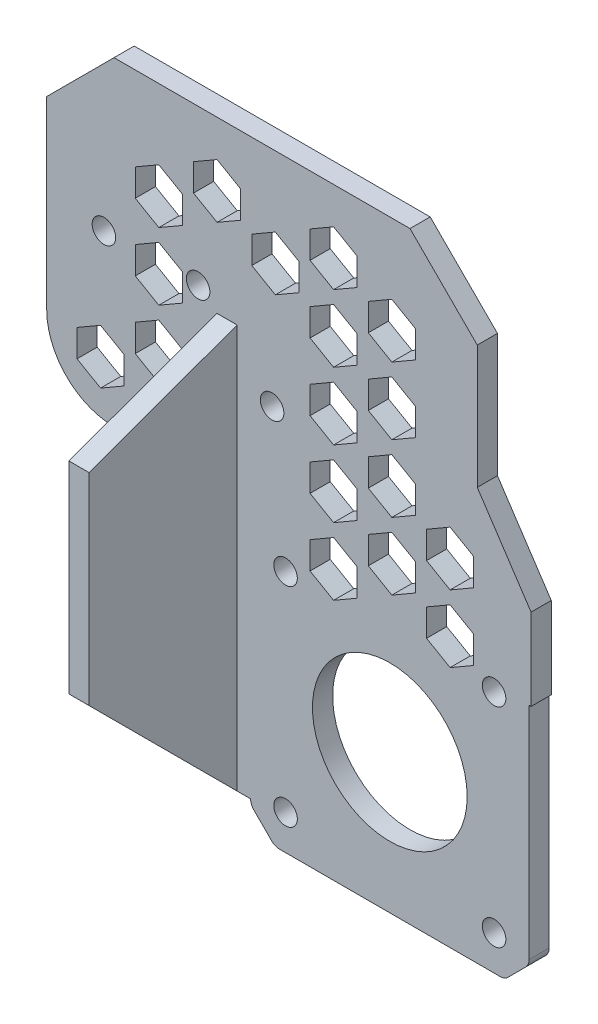
from build123d import *

# Parameters (mm, degrees)
SKETCH2_R               = 1.75
BOSS_EXTRUDE1_DEPTH     = 3
BOSS_EXTRUDE1_2_DEPTH   = 3
BOSS_EXTRUDE2_START     = -3
BOSS_EXTRUDE2_DEPTH     = 3
SKETCH5_W               = 3
SKETCH5_H               = 37.771572876
BOSS_EXTRUDE3_DEPTH     = 2
BOSS_EXTRUDE4_DEPTH     = 3
CUT_EXTRUDE1_DEPTH      = 10
SKETCH9_R               = 11.5
CUT_EXTRUDE2_DEPTH      = 10
FILL_PATTERN1_OUTLINE_R = 1.75
FILL_PATTERN1_DEPTH     = 3


# Read off the part's stored shape, not the designer's step: Fill Pattern1
with BuildPart() as part:
    # Sketch2 → Boss-Extrude1 (new body)
    with BuildSketch(Plane.XY):
        with BuildLine():
            Line((31.67162959, -17.664113805), (31.67162959, 9.835886195))
            Line((31.67162959, 9.835886195), (21.67162959, 19.835886195))
            Line((21.67162959, 19.835886195), (-22.32837041, 19.835886195))
            Line((-22.32837041, 19.835886195), (-32.32837041, 9.835886195))
            Line((-32.32837041, 9.835886195), (-32.32837041, -17.664113805))
            ThreePointArc((-32.32837041, -17.664113805), (-29.399438222, -24.735181617), (-22.32837041, -27.664113805))
            Line((-22.32837041, -27.664113805), (21.67162959, -27.664113805))
            ThreePointArc((21.67162959, -27.664113805), (28.742697402, -24.735181617), (31.67162959, -17.664113805))
        make_face()
        with Locations((18.67162959, 5.585886195)):
            Circle(SKETCH2_R, mode=Mode.SUBTRACT)
        with Locations((1.17162959, -13.314113805)):
            Circle(SKETCH2_R, mode=Mode.SUBTRACT)
        with Locations((-23.82837041, -3.214113805)):
            Circle(SKETCH2_R, mode=Mode.SUBTRACT)
        with Locations((-9.82837041, -3.214113805)):
            Circle(SKETCH2_R, mode=Mode.SUBTRACT)
    extrude(amount=BOSS_EXTRUDE1_DEPTH)



with BuildPart() as body_2:
    # Sketch2 → Boss-Extrude1 2 (new body)
    with BuildSketch(Plane.XY):
        with BuildLine():
            Line((-2.02837041, -32.69254093), (-2.02837041, -65.435686681))
            ThreePointArc((-2.02837041, -65.435686681), (-1.898965615, -66.086248516), (-1.530451938, -66.637768209))
            Line((-1.530451938, -66.637768209), (1.097975187, -69.266195333))
            ThreePointArc((1.097975187, -69.266195333), (1.64949488, -69.634709011), (2.300056715, -69.764113805))
            Line((2.300056715, -69.764113805), (35.043202465, -69.764113805))
            ThreePointArc((35.043202465, -69.764113805), (35.6937643, -69.634709011), (36.245283993, -69.266195333))
            Line((36.245283993, -69.266195333), (38.873711118, -66.637768209))
            ThreePointArc((38.873711118, -66.637768209), (39.242224795, -66.086248516), (39.37162959, -65.435686681))
            Line((39.37162959, -65.435686681), (39.37162959, -32.69254093))
            ThreePointArc((39.37162959, -32.69254093), (39.242224795, -32.041979095), (38.873711118, -31.490459402))
            Line((38.873711118, -31.490459402), (36.245283993, -28.862032277))
            ThreePointArc((36.245283993, -28.862032277), (35.6937643, -28.4935186), (35.043202465, -28.364113805))
            Line((35.043202465, -28.364113805), (2.300056715, -28.364113805))
            ThreePointArc((2.300056715, -28.364113805), (1.64949488, -28.4935186), (1.097975187, -28.862032277))
            Line((1.097975187, -28.862032277), (-1.530451938, -31.490459402))
            ThreePointArc((-1.530451938, -31.490459402), (-1.898965615, -32.041979095), (-2.02837041, -32.69254093))
        make_face()
        with Locations((34.17162959, -33.564113805)):
            Circle(SKETCH2_R, mode=Mode.SUBTRACT)
        with Locations((3.17162959, -33.564113805)):
            Circle(SKETCH2_R, mode=Mode.SUBTRACT)
        with Locations((34.17162959, -64.564113805)):
            Circle(SKETCH2_R, mode=Mode.SUBTRACT)
        with Locations((3.17162959, -64.564113805)):
            Circle(SKETCH2_R, mode=Mode.SUBTRACT)
    extrude(amount=BOSS_EXTRUDE1_2_DEPTH)


with BuildPart() as part_1:
    add(part.part)

    add(body_2.part)  # Boss-Extrude2 merges body 2
    # Sketch3 → Boss-Extrude2 (add)
    with BuildSketch(Plane.XY.offset(3).offset(BOSS_EXTRUDE2_START)):
        with BuildLine():
            Line((-2.02837041, -32.69254093), (-2.02837041, -27.664113805))
            Line((-2.02837041, -27.664113805), (21.67162959, -27.664113805))
            ThreePointArc((21.67162959, -27.664113805), (28.742697402, -24.735181617), (31.67162959, -17.664113805))
            Line((31.67162959, -17.664113805), (31.67162959, -8.484617852))
            Line((31.67162959, -8.484617852), (39.67162959, -20.545709175))
            Line((39.67162959, -20.545709175), (39.67162959, -32.69254093))
            Line((39.67162959, -32.69254093), (35.689147538, -32.69254093))
            ThreePointArc((35.689147538, -32.69254093), (34.17162959, -31.814113805), (32.654111642, -32.69254093))
            Line((32.654111642, -32.69254093), (4.689147538, -32.69254093))
            ThreePointArc((4.689147538, -32.69254093), (3.17162959, -31.814113805), (1.654111642, -32.69254093))
            Line((1.654111642, -32.69254093), (-2.02837041, -32.69254093))
        make_face()
    extrude(amount=BOSS_EXTRUDE2_DEPTH)

    # Sketch5 → Boss-Extrude3 (add)
    with BuildSketch(Plane.ZY.offset(2.02837041)):
        with Locations((1.5, -46.549900243)):
            Rectangle(SKETCH5_W, SKETCH5_H)
    extrude(amount=BOSS_EXTRUDE3_DEPTH)

    # Sketch6 → Boss-Extrude4 (add)
    with BuildSketch(Plane.ZY.offset(4.02837041)):
        Polygon((3, -27.664113805), (0, -27.664113805), (0, -65.435686681), (3, -65.435686681), (25, -43.435686681), (25, -13.435686681), (3, -5.428341527), align=None)
    extrude(amount=BOSS_EXTRUDE4_DEPTH)

    # Sketch7 → Cut-Extrude1 (cut)
    with BuildSketch(Plane.XY.offset(3)):
        Polygon((-24.32837041, -23.70556569), (-20.82837041, -21.684839748), (-20.82837041, -17.643387863), (-24.32837041, -15.622661921), (-27.82837041, -17.643387863), (-27.82837041, -21.684839748), align=None)
    extrude(amount=-CUT_EXTRUDE1_DEPTH, mode=Mode.SUBTRACT)

    # Sketch9 → Cut-Extrude2 (cut)
    with BuildSketch(Plane.XY.offset(3)):
        with Locations((18.67162959, -49.064113805)):
            Circle(SKETCH9_R)
    extrude(amount=-CUT_EXTRUDE2_DEPTH, mode=Mode.SUBTRACT)

    # Fill Pattern1 outline → Fill Pattern1 (cut)
    # profile 1 of 16: a face of its own
    with BuildSketch(Plane.XY):
        Polygon((13.812645741, 2.356612137), (10.312645741, 4.377338079), (6.812645741, 2.356612137), (6.812645741, -1.684839748), (10.312645741, -3.70556569), (13.812645741, -1.684839748), align=None)
    # profile 2 of 16: a face of its own
    with BuildSketch(Plane.XY):
        Polygon((22.472899779, 7.356612137), (18.972899779, 9.377338079), (15.472899779, 7.356612137), (15.472899779, 3.315160252), (18.972899779, 1.29443431), (22.472899779, 3.315160252), align=None)
        with Locations((18.67162959, 5.585886195)):
            Circle(FILL_PATTERN1_OUTLINE_R, mode=Mode.SUBTRACT)
    # profile 3 of 16: a face of its own
    with BuildSketch(Plane.XY):
        Polygon((-12.168116372, -12.643387863), (-15.668116372, -10.622661921), (-19.168116372, -12.643387863), (-19.168116372, -16.684839748), (-15.668116372, -18.70556569), (-12.168116372, -16.684839748), align=None)
    # profile 4 of 16: a face of its own
    with BuildSketch(Plane.XY):
        Polygon((6.812645741, -27.643387863), (6.812645741, -31.684839748), (10.312645741, -33.70556569), (13.812645741, -31.684839748), (13.812645741, -27.643387863), (10.312645741, -25.622661921), align=None)
    # profile 5 of 16: a face of its own
    with BuildSketch(Plane.XY):
        Polygon((10.312645741, 14.377338079), (6.812645741, 12.356612137), (6.812645741, 8.315160252), (10.312645741, 6.29443431), (13.812645741, 8.315160252), (13.812645741, 12.356612137), align=None)
    # profile 6 of 16: a face of its own
    with BuildSketch(Plane.XY):
        Polygon((10.312645741, -15.622661921), (6.812645741, -17.643387863), (6.812645741, -21.684839748), (10.312645741, -23.70556569), (13.812645741, -21.684839748), (13.812645741, -17.643387863), align=None)
    # profile 7 of 16: a face of its own
    with BuildSketch(Plane.XY):
        Polygon((10.312645741, -5.622661921), (6.812645741, -7.643387863), (6.812645741, -11.684839748), (10.312645741, -13.70556569), (13.812645741, -11.684839748), (13.812645741, -7.643387863), align=None)
    # profile 8 of 16: a face of its own
    with BuildSketch(Plane.XY):
        Polygon((22.472899779, -22.643387863), (18.972899779, -20.622661921), (15.472899779, -22.643387863), (15.472899779, -26.684839748), (18.972899779, -28.70556569), (22.472899779, -26.684839748), align=None)
    # profile 9 of 16: a face of its own
    with BuildSketch(Plane.XY):
        Polygon((31.133153817, -17.643387863), (27.633153817, -15.622661921), (24.133153817, -17.643387863), (24.133153817, -21.684839748), (27.633153817, -23.70556569), (31.133153817, -21.684839748), align=None)
    # profile 10 of 16: a face of its own
    with BuildSketch(Plane.XY):
        Polygon((-1.847608297, 7.356612137), (-1.847608297, 3.315160252), (1.652391703, 1.29443431), (5.152391703, 3.315160252), (5.152391703, 7.356612137), (1.652391703, 9.377338079), align=None)
    # profile 11 of 16: a face of its own
    with BuildSketch(Plane.XY):
        Polygon((15.472899779, -2.643387863), (15.472899779, -6.684839748), (18.972899779, -8.70556569), (22.472899779, -6.684839748), (22.472899779, -2.643387863), (18.972899779, -0.622661921), align=None)
    # profile 12 of 16: a face of its own
    with BuildSketch(Plane.XY):
        Polygon((-10.507862334, 12.356612137), (-10.507862334, 8.315160252), (-7.007862334, 6.29443431), (-3.507862334, 8.315160252), (-3.507862334, 12.356612137), (-7.007862334, 14.377338079), align=None)
    # profile 13 of 16: a face of its own
    with BuildSketch(Plane.XY):
        Polygon((-12.168116372, -2.643387863), (-15.668116372, -0.622661921), (-19.168116372, -2.643387863), (-19.168116372, -6.684839748), (-15.668116372, -8.70556569), (-12.168116372, -6.684839748), align=None)
    # profile 14 of 16: a face of its own
    with BuildSketch(Plane.XY):
        Polygon((18.972899779, -10.622661921), (15.472899779, -12.643387863), (15.472899779, -16.684839748), (18.972899779, -18.70556569), (22.472899779, -16.684839748), (22.472899779, -12.643387863), align=None)
    # profile 15 of 16: a face of its own
    with BuildSketch(Plane.XY):
        Polygon((-19.168116372, 7.356612137), (-19.168116372, 3.315160252), (-15.668116372, 1.29443431), (-12.168116372, 3.315160252), (-12.168116372, 7.356612137), (-15.668116372, 9.377338079), align=None)
    # profile 16 of 16: a face of its own
    with BuildSketch(Plane.XY):
        Polygon((24.133153817, -27.643387863), (24.133153817, -31.684839748), (27.633153817, -33.70556569), (31.133153817, -31.684839748), (31.133153817, -27.643387863), (27.633153817, -25.622661921), align=None)
    extrude(amount=FILL_PATTERN1_DEPTH, mode=Mode.SUBTRACT)


solid = part_1.part
